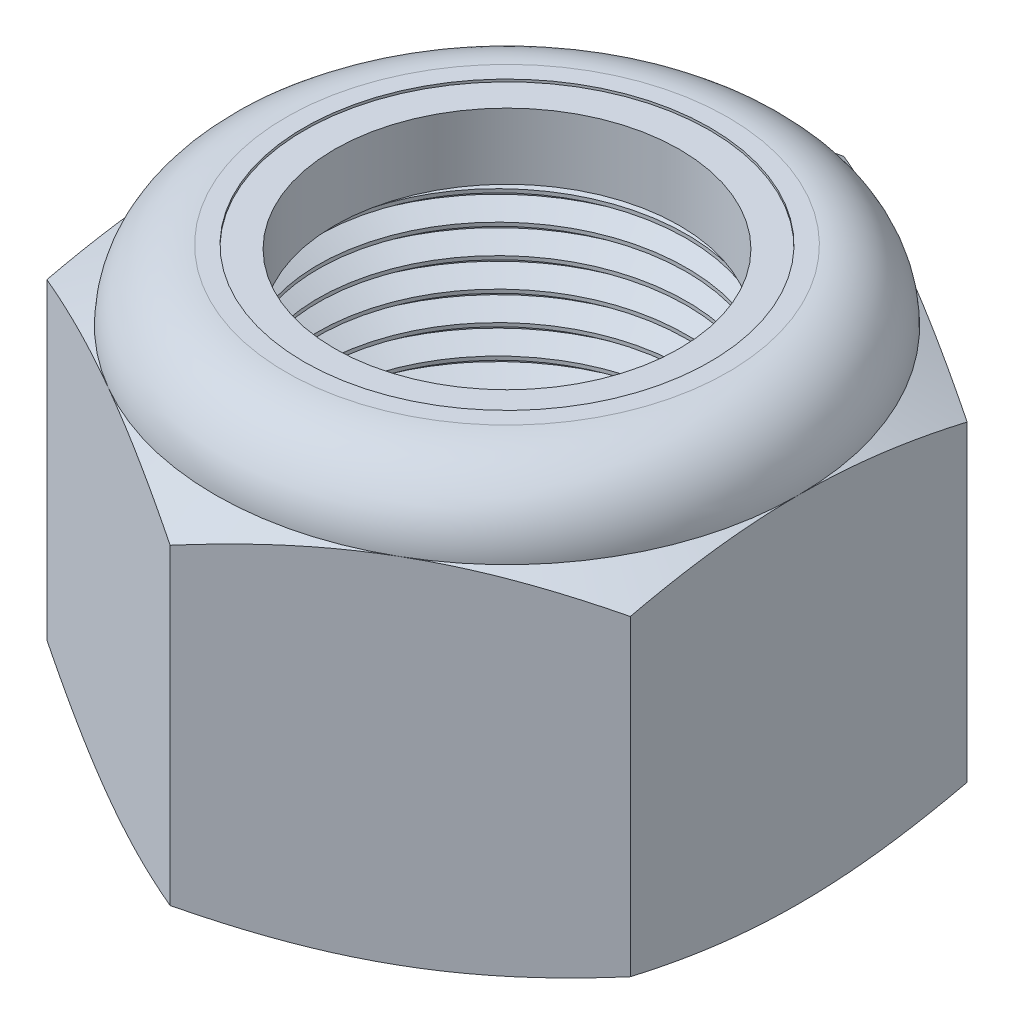
from build123d import *

# Parameters (mm, degrees)
SKETCH1_R        = 12.7
EXTRUDE1_DEPTH   = 26.590625
SKETCH2_W        = 12.7
SKETCH2_H        = 22.158854167
CUT_SWEEP1_PITCH = 1.814285714
SKETCH12_W       = 13.97
SKETCH12_H       = 22.158854167


with BuildPart() as part:
    # Sketch1 → Extrude1 (new body)
    with BuildSketch(Plane(origin=(0, 0, 0), x_dir=(1, 0, 0), z_dir=(0, 1, 0))):
        Polygon((0, 21.080501704), (-18.25625, 10.540250852), (-18.25625, -10.540250852), (0, -21.080501704), (18.25625, -10.540250852), (18.25625, 10.540250852), align=None)
        with Locations(Location((0, 0, 0), (0, 0, 270))):
            Circle(SKETCH1_R, mode=Mode.SUBTRACT)
    extrude(amount=EXTRUDE1_DEPTH)

    # Sketch5 → Cut-Revolve3 (revolve, cut)
    with BuildSketch(Plane(origin=(0, 0, 0), x_dir=(0, 0, -1), z_dir=(1, 0, 0))):
        with BuildLine():
            Line((0, 0), (18.25625, 0))
            Line((18.25625, 0), (21.080501704, 1.316970198))
            Line((21.080501704, 1.316970198), (21.080501704, 20.841883969))
            Line((21.080501704, 20.841883969), (18.25625, 22.158854167))
            ThreePointArc((18.25625, 22.158854167), (16.958214376, 25.292589376), (13.824479167, 26.590625))
            Line((13.824479167, 26.590625), (13.824479167, 27.860625))
            Line((13.824479167, 27.860625), (22.350501704, 27.860625))
            Line((22.350501704, 27.860625), (22.350501704, -1.27))
            Line((22.350501704, -1.27), (0, -1.27))
            Line((0, -1.27), (0, 0))
        make_face()
    revolve(axis=Axis((0, 0, 0), (0, 1, 0)), mode=Mode.SUBTRACT)

    # Sketch6 → Cut-Revolve4 (revolve, cut)
    with BuildSketch(Plane(origin=(0, 0, 0), x_dir=(0, 0, -1), z_dir=(1, 0, 0)), mode=Mode.PRIVATE) as cut_revolve4_sk:
        with BuildLine():
            Line((0, 22.158854167), (18.10385, 22.158854167))
            ThreePointArc((18.10385, 22.158854167), (16.850451302, 25.184826302), (13.824479167, 26.438225))
            Line((13.824479167, 26.438225), (6.912239583, 26.438225))
            Line((6.912239583, 26.438225), (6.912239583, 27.860625))
            Line((6.912239583, 27.860625), (0, 27.860625))
            Line((0, 27.860625), (0, 22.158854167))
        make_face()
    revolve(cut_revolve4_sk.sketch.rotate(Axis((0, 27.860625, 0), (0, -1, 0)), 180), axis=Axis((0, 27.860625, 0), (0, -1, 0)), mode=Mode.SUBTRACT)

    # Sketch4 → Cut-Revolve2 (revolve, cut)
    with BuildSketch(Plane(origin=(0, 0, 0), x_dir=(0, 0, -1), z_dir=(1, 0, 0))):
        Polygon((0, 22.158854167), (13.97, 22.158854167), (0, 15.644536182), align=None)
        Polygon((0, 6.514317984), (13.97, 0), (0, 0), align=None)
    revolve(axis=Axis((0, 0, 0), (0, 1, 0)), mode=Mode.SUBTRACT)

    # Sketch12 → Revolve4 (revolve)
    with BuildSketch(Plane(origin=(0, 0, 0), x_dir=(0, 0, -1), z_dir=(1, 0, 0)), mode=Mode.PRIVATE) as revolve4_sk:
        with Locations((6.985, 11.079427084)):
            Rectangle(SKETCH12_W, SKETCH12_H)
    revolve(revolve4_sk.sketch.rotate(Axis((0, 0, 0), (0, 1, 0)), 14.722507914), axis=Axis((0, 0, 0), (0, 1, 0)))


with BuildPart() as body_2:
    # Sketch7 → Revolve2 (revolve)
    with BuildSketch(Plane(origin=(0, 0, 0), x_dir=(0, 0, -1), z_dir=(1, 0, 0))):
        with BuildLine():
            Line((10.795, 22.235054167), (18.026959222, 22.235054167))
            ThreePointArc((18.026959222, 22.235054167), (16.769505774, 25.157764525), (13.824479167, 26.362025))
            Line((13.824479167, 26.362025), (10.795, 26.362025))
            Line((10.795, 26.362025), (10.795, 22.235054167))
        make_face()
    revolve(axis=Axis((0, 22.235054167, 0), (0, 1, 0)))


with BuildPart() as body_3:
    # Sketch2 → Revolve1 (revolve)
    with BuildSketch(Plane(origin=(0, 0, 0), x_dir=(0, 0, -1), z_dir=(1, 0, 0))):
        with Locations((6.35, 11.079427084)):
            Rectangle(SKETCH2_W, SKETCH2_H)
    revolve(axis=Axis((0, -12.7, 0), (0, 1, 0)))

    # Cut-Sweep1: the profile of Sketch9 screwed along a right-hand helix of 15.65625 turns, 10 arcs to a turn; built about Z, then put on its axis
    cut_sweep1_z = Axis((0, 0, 0), (0, 0, 1))
    cut_sweep1_corners = [(12.89640219, 0, 0.113392857), (12.798201095, 0, -1.644196429), (11.521586861, 0, -0.907142857), (11.521586861, 0, -0.680357143)]
    with BuildLine(mode=Mode.PRIVATE) as cut_sweep1_profile:
        Line(cut_sweep1_corners[0], cut_sweep1_corners[1])
        Line(cut_sweep1_corners[1], cut_sweep1_corners[2])
        Line(cut_sweep1_corners[2], cut_sweep1_corners[3])
        Line(cut_sweep1_corners[3], cut_sweep1_corners[0])
    cut_sweep1_cap = Face(cut_sweep1_profile.wire())
    cut_sweep1_turn_angles = [0, 18, 36, 54, 72, 90, 108, 126, 144, 162, 180, 198, 216, 234, 252, 270, 288, 306, 324, 342, 360]
    cut_sweep1_turn_weights = [1, 0.9510565162951535, 1, 0.9510565162951535, 1, 0.9510565162951535, 1, 0.9510565162951535, 1, 0.9510565162951535, 1, 0.9510565162951535, 1, 0.9510565162951535, 1, 0.9510565162951535, 1, 0.9510565162951535, 1, 0.9510565162951535, 1]
    cut_sweep1_turn_rails = [Edge.make_bspline([Vector(p[0], p[1], 0).rotate(cut_sweep1_z, cut_sweep1_turn_angles[k]) / cut_sweep1_turn_weights[k] + Vector(0, 0, p[2] + CUT_SWEEP1_PITCH * cut_sweep1_turn_angles[k] / 360) for k in range(21)], [0, 0, 0, 1, 1, 2, 2, 3, 3, 4, 4, 5, 5, 6, 6, 7, 7, 8, 8, 9, 9, 10, 10, 10], 2, cut_sweep1_turn_weights) for p in cut_sweep1_corners]
    cut_sweep1_turn_sides = [Face.make_surface_from_curves(cut_sweep1_turn_rails[p[0]], cut_sweep1_turn_rails[p[1]]) for p in [(0, 1), (1, 2), (2, 3), (3, 0)]]
    cut_sweep1_last_angles = [5400, 5418, 5436, 5454, 5472, 5490, 5508, 5526, 5544, 5562, 5580, 5598, 5616, 5626.125, 5636.25]
    cut_sweep1_last_weights = [1, 0.9510565162951535, 1, 0.9510565162951535, 1, 0.9510565162951535, 1, 0.9510565162951535, 1, 0.9510565162951535, 1, 0.9510565162951535, 1, 0.9844265680899237, 1]
    cut_sweep1_last_rails = [Edge.make_bspline([Vector(p[0], p[1], 0).rotate(cut_sweep1_z, cut_sweep1_last_angles[k]) / cut_sweep1_last_weights[k] + Vector(0, 0, p[2] + CUT_SWEEP1_PITCH * cut_sweep1_last_angles[k] / 360) for k in range(15)], [0, 0, 0, 1, 1, 2, 2, 3, 3, 4, 4, 5, 5, 6, 6, 7, 7, 7], 2, cut_sweep1_last_weights) for p in cut_sweep1_corners]
    cut_sweep1_last_sides = [Face.make_surface_from_curves(cut_sweep1_last_rails[p[0]], cut_sweep1_last_rails[p[1]]) for p in [(0, 1), (1, 2), (2, 3), (3, 0)]]
    cut_sweep1 = Plane(origin=(0, 22.158854167, 0), x_dir=(0, 0, -1), z_dir=(0, -1, 0)) * Solid(Shell([*[p.moved(Location((0, 0, CUT_SWEEP1_PITCH * i))) for i in range(15) for p in cut_sweep1_turn_sides], *cut_sweep1_last_sides, cut_sweep1_cap, cut_sweep1_cap.rotate(cut_sweep1_z, 5636.25).moved(Location((0, 0, CUT_SWEEP1_PITCH * 5636.25 / 360)))]))
    add(cut_sweep1, mode=Mode.SUBTRACT)

    # Sketch11 → Revolve3 (revolve)
    with BuildSketch(Plane(origin=(0, 0, 0), x_dir=(0, 0, -1), z_dir=(1, 0, 0))):
        Polygon((0, 0), (13.97, 0), (0, 6.514317984), align=None)
    revolve(axis=Axis((0, 26.590625, 0), (0, -1, 0)))


with BuildPart() as part_1:
    add(part.part)

    # Combine1: cut body 3
    add(body_3.part, mode=Mode.SUBTRACT)


solid = Compound([body_2.part, part_1.part])
